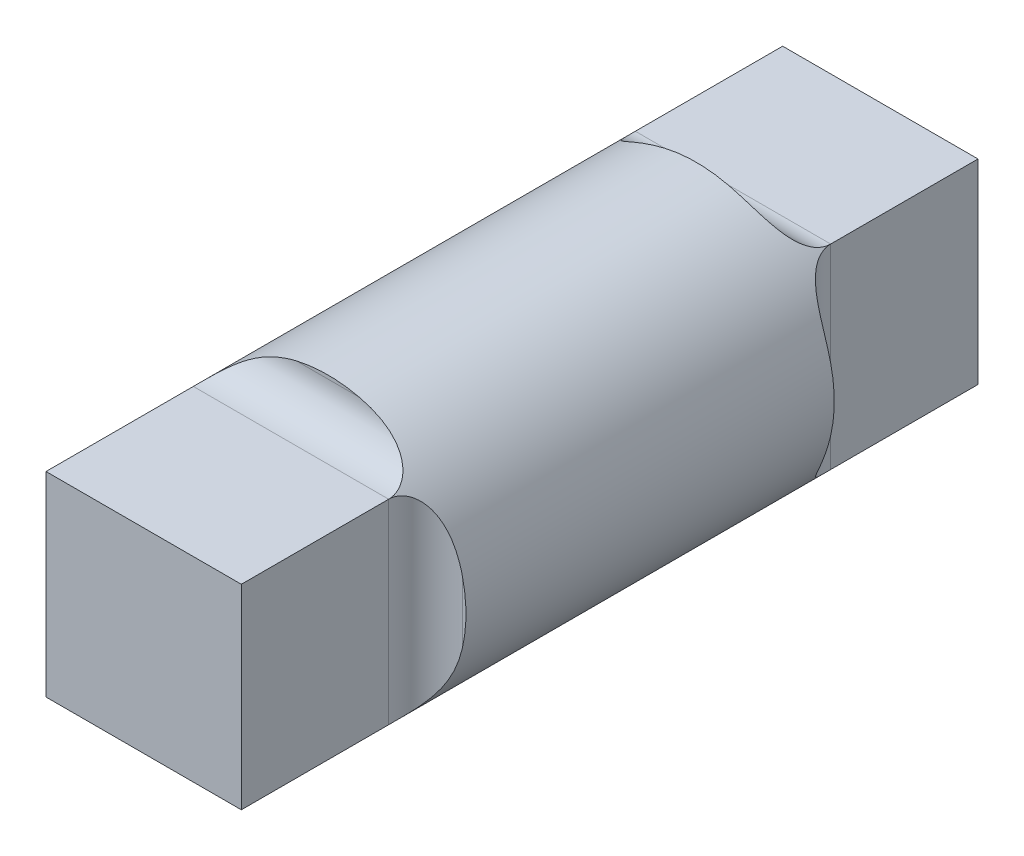
from build123d import *

# Parameters (mm, degrees)
SKETCH2_R           = 3.75
BOSS_EXTRUDE1_DEPTH = 10
SKETCH3_W           = 5.303300858
SKETCH3_H           = 5.303300858
BOSS_EXTRUDE2_DEPTH = 5
SKETCH4_W           = 5.303300858
SKETCH4_H           = 5.303300858
BOSS_EXTRUDE3_DEPTH = 5
FILLET1_R           = 1
FILLET3_R           = 1
FILLET4_R           = 1
FILLET5_R           = 1
FILLET6_R           = 1
FILLET7_R           = 1
FILLET8_R           = 1
FILLET9_R           = 1


with BuildPart() as part:
    # Sketch2 → Boss-Extrude1 (new body)
    with BuildSketch(Plane.XY):
        Circle(SKETCH2_R)
    extrude(amount=BOSS_EXTRUDE1_DEPTH)

    # Sketch3 → Boss-Extrude2 (add)
    with BuildSketch(Plane.XY.offset(10)):
        Rectangle(SKETCH3_W, SKETCH3_H)
    extrude(amount=BOSS_EXTRUDE2_DEPTH)

    # Sketch4 → Boss-Extrude3 (add)
    with BuildSketch(Plane(origin=(0, 0, 0), x_dir=(-1, 0, 0), z_dir=(0, 0, -1))):
        Rectangle(SKETCH4_W, SKETCH4_H)
    extrude(amount=BOSS_EXTRUDE3_DEPTH)

    # Fillet1
    # the kernel refuses this fillet: 1 mm, written as the material it adds along each edge
    with BuildSketch(Plane(origin=(-2.651650429, 2.651650429, 10), x_dir=(-1, 0, 0), z_dir=(0, -1, 0))) as fillet1_piece_1_section:
        with BuildLine():
            CenterArc((FILLET1_R, -FILLET1_R), FILLET1_R, 90, 90)
            Line((0, -FILLET1_R), (0, 0))
            Line((0, 0), (FILLET1_R, 0))
        make_face()
    fillet1_piece_1 = extrude(amount=5.303300859, mode=Mode.PRIVATE)
    fillet1_piece_1 = fillet1_piece_1 & Plane(origin=(0, 0, 10.241590104), x_dir=(1, 0, 0), z_dir=(0, 0, -1)) * Cylinder(3.75, 15, mode=Mode.PRIVATE)
    add(fillet1_piece_1)

    # Fillet3
    # the kernel refuses this fillet: 1 mm, written as the material it adds along each edge
    with BuildSketch(Plane(origin=(2.651650429, 2.651650429, 10), x_dir=(0, 0, 1), z_dir=(-1, 0, 0))) as fillet3_piece_1_section:
        with BuildLine():
            CenterArc((FILLET3_R, FILLET3_R), FILLET3_R, 180, 90)
            Line((0, FILLET3_R), (0, 0))
            Line((0, 0), (FILLET3_R, 0))
        make_face()
    fillet3_piece_1 = extrude(amount=7.803300859, mode=Mode.PRIVATE)
    fillet3_piece_1 = fillet3_piece_1 & Plane(origin=(0, 0, 10.24158994), x_dir=(1, 0, 0), z_dir=(0, 0, -1)) * Cylinder(3.75, 20, mode=Mode.PRIVATE)
    add(fillet3_piece_1)

    # Fillet4
    # the kernel refuses this fillet: 1 mm, written as the material it adds along each edge
    with BuildSketch(Plane(origin=(2.651650429, -2.651650429, 10), x_dir=(0, 0, 1), z_dir=(0, 1, 0))) as fillet4_piece_1_section:
        with BuildLine():
            CenterArc((FILLET4_R, FILLET4_R), FILLET4_R, 180, 90)
            Line((0, FILLET4_R), (0, 0))
            Line((0, 0), (FILLET4_R, 0))
        make_face()
    fillet4_piece_1 = extrude(amount=7.803300859, mode=Mode.PRIVATE)
    fillet4_piece_1 = fillet4_piece_1 & Plane(origin=(0, 0, 10.24158994), x_dir=(1, 0, 0), z_dir=(0, 0, -1)) * Cylinder(3.75, 20, mode=Mode.PRIVATE)
    add(fillet4_piece_1)

    # Fillet5
    fillet5_edges = [part.edges().sort_by_distance(p)[0] for p in [
        (0, -2.651650429, 10),
    ]]
    fillet(fillet5_edges, radius=FILLET5_R)

    # Fillet6
    # the kernel refuses this fillet: 1 mm, written as the material it adds along each edge
    with BuildSketch(Plane(origin=(-2.651650429, 2.651650429, 0), x_dir=(0, 1, 0), z_dir=(1, 0, 0))) as fillet6_piece_1_section:
        with BuildLine():
            CenterArc((FILLET6_R, -FILLET6_R), FILLET6_R, 90, 90)
            Line((0, -FILLET6_R), (0, 0))
            Line((0, 0), (FILLET6_R, 0))
        make_face()
    fillet6_piece_1 = extrude(amount=5.303300859, mode=Mode.PRIVATE)
    fillet6_piece_1 = fillet6_piece_1 & Plane(origin=(0, 0, -0.241590055), x_dir=(1, 0, 0), z_dir=(0, 0, -1)) * Cylinder(3.75, 15, mode=Mode.PRIVATE)
    add(fillet6_piece_1)

    # Fillet7
    # the kernel refuses this fillet: 1 mm, written as the material it adds along each edge
    with BuildSketch(Plane(origin=(-2.651650429, -2.651650429, 0), x_dir=(0, 0, -1), z_dir=(0, 1, 0))) as fillet7_piece_1_section:
        with BuildLine():
            CenterArc((FILLET7_R, FILLET7_R), FILLET7_R, 180, 90)
            Line((0, FILLET7_R), (0, 0))
            Line((0, 0), (FILLET7_R, 0))
        make_face()
    fillet7_piece_1 = extrude(amount=7.803300859, mode=Mode.PRIVATE)
    fillet7_piece_1 = fillet7_piece_1 & Plane(origin=(0, 0, -0.241590003), x_dir=(1, 0, 0), z_dir=(0, 0, -1)) * Cylinder(3.75, 20, mode=Mode.PRIVATE)
    add(fillet7_piece_1)

    # Fillet8
    # the kernel refuses this fillet: 1 mm, written as the material it adds along each edge
    with BuildSketch(Plane(origin=(2.651650429, -2.651650429, 0), x_dir=(0, 0, -1), z_dir=(-1, 0, 0))) as fillet8_piece_1_section:
        with BuildLine():
            CenterArc((FILLET8_R, FILLET8_R), FILLET8_R, 180, 90)
            Line((0, FILLET8_R), (0, 0))
            Line((0, 0), (FILLET8_R, 0))
        make_face()
    fillet8_piece_1 = extrude(amount=7.803300859, mode=Mode.PRIVATE)
    fillet8_piece_1 = fillet8_piece_1 & Plane(origin=(0, 0, -0.241589985), x_dir=(1, 0, 0), z_dir=(0, 0, -1)) * Cylinder(3.75, 20, mode=Mode.PRIVATE)
    add(fillet8_piece_1)

    # Fillet9
    fillet9_edges = [part.edges().sort_by_distance(p)[0] for p in [
        (2.651650429, 0, 0),
    ]]
    fillet(fillet9_edges, radius=FILLET9_R)


solid = part.part
